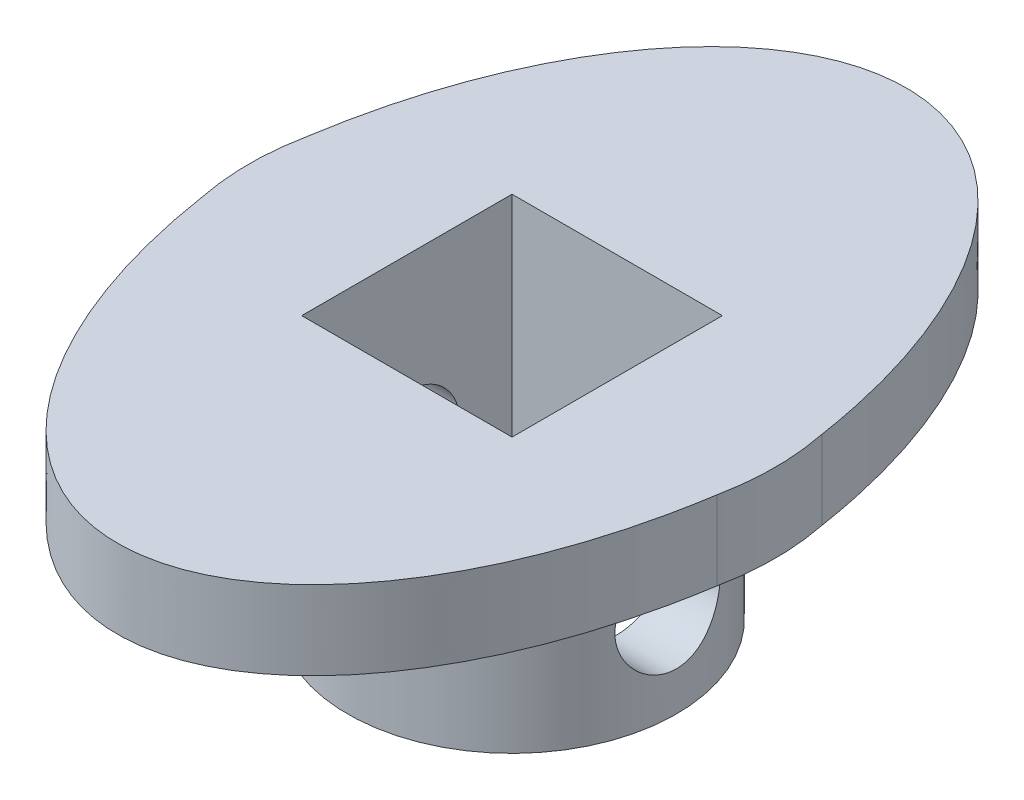
from build123d import *

# Parameters (mm, degrees)
BOSS_EXTRUDE1_DEPTH     = 3.81
SKETCH3_R               = 7.9375
BOSS_EXTRUDE2_DEPTH     = 8.89
SKETCH2_W               = 10.16
SKETCH2_H               = 10.16
CUT_EXTRUDE1_DEPTH      = 27.181720844
CUT_EXTRUDE2_DEPTH      = 30.459141437
CUT_EXTRUDE2_DEPTH_BACK = 30.459141437
SKETCH4_R               = 2.55


# Read off the part's stored shape, not the designer's step: Boss-Extrude1
with BuildPart() as part:
    # Boss-Extrude1 outline → Boss-Extrude1 (new body)
    with BuildSketch(Plane(origin=(0, 0, 0), x_dir=(1, 0, 0), z_dir=(0, 1, 0))):
        with BuildLine():
            ThreePointArc((12.443407893, -2.54), (12.7, 0), (12.443407893, 2.54))
            add(Edge.make_bspline(
                [(-12.443407893, 2.54), (0, 83.206957613), (12.443407893, 2.54)],
                knots=[0, 0, 0, 1, 1, 1], degree=2, weights=[1, 0.257337639, 1]))
            ThreePointArc((-12.443407893, 2.54), (-12.7, 0), (-12.443407893, -2.54))
            add(Edge.make_bspline(
                [(-12.443407893, -2.54), (0, -83.206957613), (12.443407893, -2.54)],
                knots=[0, 0, 0, 1, 1, 1], degree=2, weights=[1, 0.257337639, 1]))
        make_face()
    extrude(amount=BOSS_EXTRUDE1_DEPTH)

    # Sketch3 → Boss-Extrude2 (add)
    with BuildSketch(Plane.XZ):
        with Locations(Location((0, 0, 0), (0, 0, 270))):
            Circle(SKETCH3_R)
    extrude(amount=BOSS_EXTRUDE2_DEPTH)

    # Sketch2 → Cut-Extrude1 (cut, through all)
    with BuildSketch(Plane(origin=(0, 3.81, 0), x_dir=(1, 0, 0), z_dir=(0, 1, 0))):
        Rectangle(SKETCH2_W, SKETCH2_H)
    extrude(amount=-CUT_EXTRUDE1_DEPTH, mode=Mode.SUBTRACT)

    # Sketch4 → Cut-Extrude2 (cut, two sides: drawn at the far end of the back side and taken through both)
    with BuildSketch(Plane(origin=(7.9375, 0, 0), x_dir=(0, 0, -1), z_dir=(1, 0, 0)).offset(-CUT_EXTRUDE2_DEPTH_BACK)):
        with Locations((0, -4.445)):
            Circle(SKETCH4_R)
    extrude(amount=CUT_EXTRUDE2_DEPTH + CUT_EXTRUDE2_DEPTH_BACK, mode=Mode.SUBTRACT)


solid = part.part
